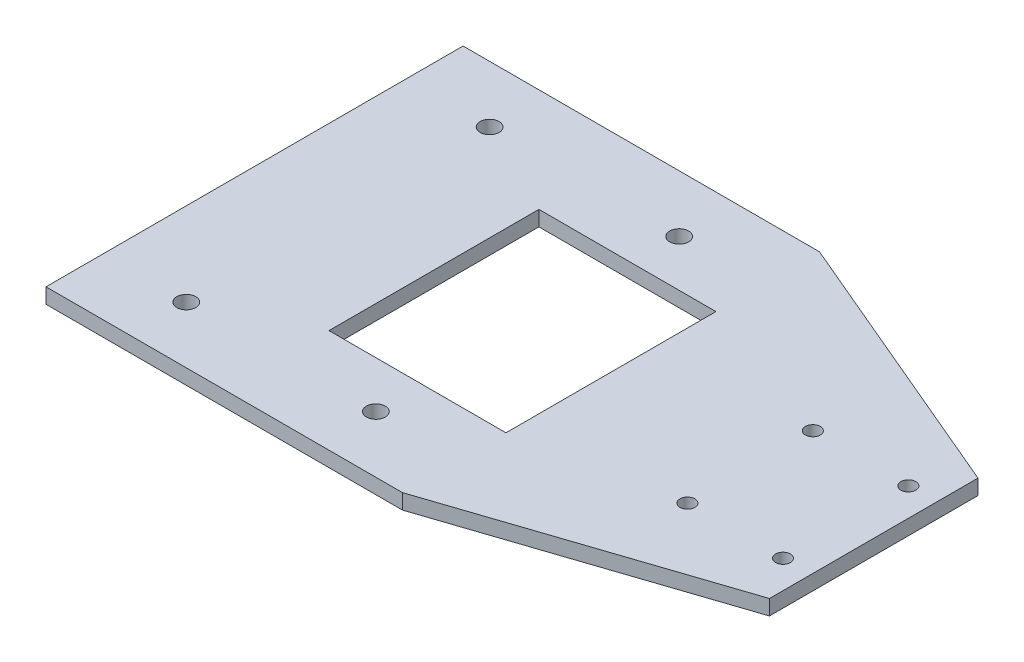
from build123d import *

# Parameters (mm, degrees)
SKETCH1_R           = 1.5875
SKETCH1_R_2         = 1.25
BOSS_EXTRUDE1_DEPTH = 2.54
SKETCH2_W           = 29.643243896
SKETCH2_H           = 35.163967442
CUT_EXTRUDE1_DEPTH  = 2.54


with BuildPart() as part:
    # Sketch1 → Boss-Extrude1 (new body)
    with BuildSketch(Plane(origin=(0, 0, 0), x_dir=(1, 0, 0), z_dir=(0, 1, 0))):
        Polygon((75.945, 15.376423832), (29.845, 34.925), (-29.845, 34.925), (-29.845, -34.925), (29.845, -34.925), (75.945, -19.548576168), align=None)
        with Locations((-15.875, 25.4)):
            Circle(SKETCH1_R, mode=Mode.SUBTRACT)
        with Locations((15.875, 25.4)):
            Circle(SKETCH1_R, mode=Mode.SUBTRACT)
        with Locations((15.875, -25.4)):
            Circle(SKETCH1_R, mode=Mode.SUBTRACT)
        with Locations((-15.875, -25.4)):
            Circle(SKETCH1_R, mode=Mode.SUBTRACT)
        with Locations((71.245, 8.413923832)):
            Circle(SKETCH1_R_2, mode=Mode.SUBTRACT)
        with Locations((71.245, -12.586076168)):
            Circle(SKETCH1_R_2, mode=Mode.SUBTRACT)
        with Locations((55.245, -12.586076168)):
            Circle(SKETCH1_R_2, mode=Mode.SUBTRACT)
        with Locations((55.245, 8.413923832)):
            Circle(SKETCH1_R_2, mode=Mode.SUBTRACT)
    extrude(amount=BOSS_EXTRUDE1_DEPTH)

    # Sketch2 → Cut-Extrude1 (cut)
    with BuildSketch(Plane(origin=(0, 2.54, 0), x_dir=(1, 0, 0), z_dir=(0, 1, 0))):
        with Locations((15.023378052, 0)):
            Rectangle(SKETCH2_W, SKETCH2_H)
    extrude(amount=-CUT_EXTRUDE1_DEPTH, mode=Mode.SUBTRACT)


solid = part.part
